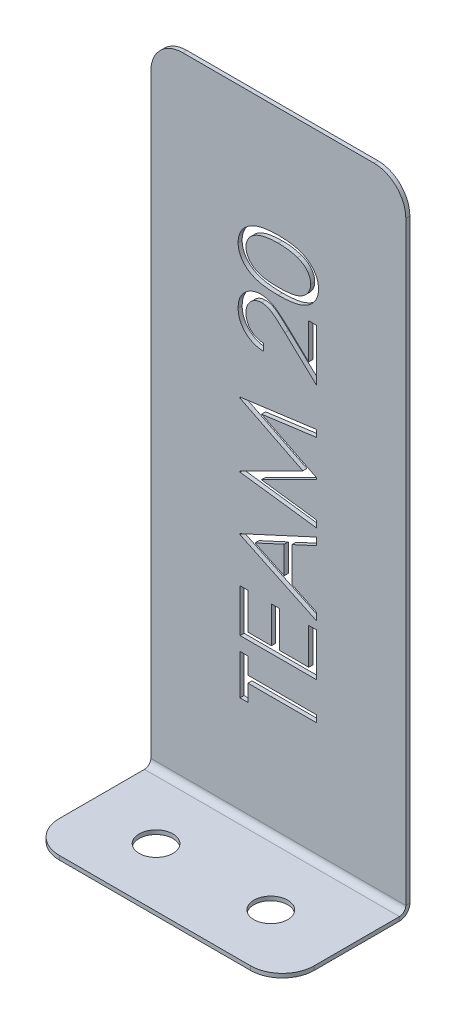
from build123d import *

# Parameters (mm, degrees)
SKETCH1_W                    = 40
SKETCH1_H                    = 100
BASE_FLANGE1_DEPTH           = 0.635
EDGE_FLANGE1_STRIP_W         = 4.54
EDGE_FLANGE1_STRIP_H         = 0.635
EDGE_FLANGE1_STRIP_CUT_DEPTH = 40
EDGE_FLANGE1_DEPTH           = 40
SKETCH9_R                    = 2.65
CUT_EXTRUDE1_DEPTH           = 104.191116139
FILLET1_R                    = 5
CUT_EXTRUDE2_DEPTH           = 58.227643888


# Sheet-metal steps are written as plain solids
with BuildPart() as part:
    # Sketch1 → Base-Flange1 (new body)
    with BuildSketch(Plane.XY):
        Rectangle(SKETCH1_W, SKETCH1_H)
    extrude(amount=-BASE_FLANGE1_DEPTH)

    # Edge-Flange1 strip (across the edge) → Edge-Flange1 strip cut (cut)
    with BuildSketch(Plane(origin=(-20, -50, 0), x_dir=(0, 1, 0), z_dir=(1, 0, 0))):
        with Locations((-0.635, -0.3175)):
            Rectangle(EDGE_FLANGE1_STRIP_W, EDGE_FLANGE1_STRIP_H)
    extrude(amount=EDGE_FLANGE1_STRIP_CUT_DEPTH, mode=Mode.SUBTRACT)

    # Edge-Flange1 section (across the edge) → Edge-Flange1 (add)
    with BuildSketch(Plane(origin=(-20, -50, 0), x_dir=(0, 1, 0), z_dir=(1, 0, 0))):
        with BuildLine():
            Line((0, 1), (0, 19.365))
            Line((0, 19.365), (0.635, 19.365))
            Line((0.635, 19.365), (0.635, 1))
            ThreePointArc((0.635, 1), (0.927893219, 0.292893219), (1.635, 0))
            Line((1.635, 0), (1.635, -0.635))
            ThreePointArc((1.635, -0.635), (0.478880413, -0.156119587), (0, 1))
        make_face()
    extrude(amount=EDGE_FLANGE1_DEPTH)

    # Sketch9 → Cut-Extrude1 (cut, through all)
    with BuildSketch(Plane(origin=(0, -49.365, 0), x_dir=(1, 0, 0), z_dir=(0, 1, 0))):
        with Locations(Location((-9, -10.1825, 0), (0, 0, 270))):
            Circle(SKETCH9_R)
        with Locations(Location((9, -10.1825, 0), (0, 0, 270))):
            Circle(SKETCH9_R)
    extrude(amount=-CUT_EXTRUDE1_DEPTH, mode=Mode.SUBTRACT)

    # Fillet1
    fillet1_edges = [part.edges().sort_by_distance(p)[0] for p in [
        (-20, -49.6825, 19.365),
        (20, -49.6825, 19.365),
        (-20, 50, -0.3175),
        (20, 50, -0.3175),
    ]]
    fillet(fillet1_edges, radius=FILLET1_R)

    # Sketch10 → Cut-Extrude2 (cut, through all)
    # profile 1 of 6: a face of its own
    with BuildSketch(Plane.XY):
        with BuildLine():
            add(Edge.make_bspline(
                [(0.004807692, 24.538461538), (-0.187526209, 24.539586172), (-0.561137583, 24.541770789), (-1.10554207, 24.566073947), (-1.616263062, 24.606446548), (-2.093325, 24.661774686), (-2.536851058, 24.729104896), (-2.945655912, 24.818986591), (-3.321631799, 24.921201827), (-3.666004222, 25.039667648), (-3.983414573, 25.173339059), (-4.279725727, 25.318831512), (-4.554511619, 25.481898185), (-4.812078451, 25.653292725), (-5.048492449, 25.8396875), (-5.266477552, 26.037085852), (-5.46419545, 26.249435775), (-5.64178154, 26.474677669), (-5.797498629, 26.711284965), (-5.935504277, 26.952792072), (-6.049178794, 27.203514183), (-6.142167679, 27.460150683), (-6.218076651, 27.723242465), (-6.270218337, 27.992722364), (-6.302967465, 28.269215054), (-6.306102418, 28.455836022), (-6.307692308, 28.550480769)],
                knots=[0, 0, 0, 0, 1.646148282, 3.197666765, 4.66315463, 6.030252048, 7.307778049, 8.501004361, 9.610818041, 10.641065266, 11.615491391, 12.557119604, 13.464013759, 14.348536654, 15.203310953, 16.038349431, 16.863300206, 17.683791446, 18.490318933, 19.285717724, 20.06220424, 20.843281102, 21.620494212, 22.403315558, 23.190242141, 24, 24, 24, 24], degree=3))
            add(Edge.make_bspline(
                [(-6.307692308, 28.550480769), (-6.306368022, 28.645962979), (-6.303733161, 28.83593897), (-6.266645896, 29.115796621), (-6.218776291, 29.390779629), (-6.142001326, 29.656715959), (-6.050130125, 29.918633956), (-5.928907534, 30.170020244), (-5.797068553, 30.419750089), (-5.636236086, 30.656478599), (-5.458489743, 30.887278788), (-5.256702203, 31.103629868), (-5.036457957, 31.31106235), (-4.792844916, 31.501741592), (-4.529598388, 31.68383984), (-4.244511611, 31.850444461), (-3.938216375, 32.005020527), (-3.612132621, 32.150473658), (-3.257550147, 32.277668581), (-2.876680574, 32.390755034), (-2.466074948, 32.483448518), (-2.028020601, 32.560104399), (-1.560347418, 32.619603954), (-1.064002958, 32.662906725), (-0.538676703, 32.685788475), (-0.179506822, 32.690096798), (0.004807692, 32.692307692)],
                knots=[0, 0, 0, 0, 0.810910589, 1.61342667, 2.396193133, 3.181089899, 3.963115317, 4.752255436, 5.550715454, 6.36105385, 7.181178335, 8.024612154, 8.872680183, 9.750181803, 10.651284446, 11.591556747, 12.554036451, 13.566402641, 14.62422919, 15.753422176, 16.94128843, 18.199818041, 19.531985927, 20.947085226, 22.433341622, 24, 24, 24, 24], degree=3))
            add(Edge.make_bspline(
                [(0.004807692, 32.692307692), (0.188316627, 32.690048158), (0.546676684, 32.685635691), (1.069663865, 32.663397475), (1.563332919, 32.618546268), (2.028210173, 32.56326151), (2.464511161, 32.485748854), (2.871951588, 32.392352513), (3.251973981, 32.285941271), (3.601855528, 32.156794249), (3.927373428, 32.014726657), (4.231416494, 31.860316464), (4.516427983, 31.694652019), (4.780368865, 31.515284822), (5.023004084, 31.321469101), (5.244003728, 31.11418201), (5.447074722, 30.895941931), (5.626779302, 30.663796218), (5.788836267, 30.424862727), (5.92545961, 30.175107511), (6.043835721, 29.920922476), (6.140619111, 29.659769829), (6.21567576, 29.392052774), (6.267273119, 29.11688129), (6.303542099, 28.835899477), (6.306304115, 28.645949769), (6.307692308, 28.550480769)],
                knots=[0, 0, 0, 0, 1.561645053, 3.049612875, 4.452756685, 5.778837748, 7.032101753, 8.221335837, 9.334924186, 10.387562255, 11.392109817, 12.355697819, 13.287721948, 14.19548756, 15.068665045, 15.927346723, 16.771751757, 17.602390507, 18.423119567, 19.225778204, 20.022010933, 20.807278863, 21.593079439, 22.384715467, 23.188155646, 24, 24, 24, 24], degree=3))
            add(Edge.make_bspline(
                [(6.307692308, 28.550480769), (6.306093375, 28.455838093), (6.302940591, 28.269221208), (6.270322083, 27.992698606), (6.217880356, 27.72430166), (6.144452007, 27.462705921), (6.05457254, 27.206569338), (5.937474301, 26.959381916), (5.802614241, 26.718396155), (5.649031442, 26.484251453), (5.473065645, 26.261361114), (5.278467095, 26.048419231), (5.060245625, 25.850972201), (4.821836902, 25.666193636), (4.563886857, 25.492987148), (4.286222382, 25.331329587), (3.988369362, 25.182786045), (3.668450488, 25.046830883), (3.321633866, 24.926291462), (2.944699582, 24.820228541), (2.533819106, 24.735519343), (2.091078561, 24.663715203), (1.615578331, 24.606177605), (1.107146387, 24.566090712), (0.566748199, 24.54178924), (0.195539345, 24.539591014), (0.004807692, 24.538461538)],
                knots=[0, 0, 0, 0, 0.810927267, 1.598990287, 2.382942141, 3.152806972, 3.926217614, 4.706701772, 5.493896336, 6.292070767, 7.104102563, 7.925577746, 8.761822141, 9.623241997, 10.509042271, 11.423174113, 12.375371989, 13.360203808, 14.400680605, 15.520553799, 16.714061498, 17.994519714, 19.364400916, 20.818312473, 22.365209998, 24, 24, 24, 24], degree=3))
        make_face()
        with BuildLine():
            add(Edge.make_bspline(
                [(0, 25.615384615), (0.160280612, 25.615803128), (0.471353808, 25.61661538), (0.922597775, 25.637220777), (1.344180174, 25.665901388), (1.735936465, 25.701983248), (2.09649747, 25.756020964), (2.427362174, 25.817330057), (2.727918151, 25.890866572), (3.000791904, 25.978302491), (3.249847436, 26.077900512), (3.481722958, 26.186453118), (3.699166629, 26.304102846), (3.901650898, 26.433261257), (4.086700617, 26.576481906), (4.259006374, 26.727125065), (4.412575526, 26.891977126), (4.596788427, 27.119979819), (4.787136655, 27.421001089), (4.952895609, 27.800269776), (5.057063798, 28.189990542), (5.070310992, 28.454509066), (5.076923077, 28.586538462)],
                knots=[0, 0, 0, 0, 1.459098681, 2.831824031, 4.11146945, 5.306290378, 6.412266529, 7.42953815, 8.369053297, 9.227277979, 10.03601793, 10.809473603, 11.557037441, 12.285528272, 12.993193355, 13.685654407, 14.36688038, 15.041354379, 16.352855396, 17.594313975, 18.799247529, 20, 20, 20, 20], degree=3))
            add(Edge.make_bspline(
                [(5.076923077, 28.586538462), (5.071133406, 28.719332124), (5.059574602, 28.984448402), (4.958693916, 29.37381117), (4.794693956, 29.748679123), (4.607327889, 30.044520938), (4.427750656, 30.268967564), (4.274820325, 30.429839203), (4.103533566, 30.577476791), (3.91873862, 30.717507796), (3.716889368, 30.845938625), (3.498960747, 30.962726607), (3.264346365, 31.069298062), (3.10056441, 31.130014794), (3.016826923, 31.161057692)],
                knots=[0, 0, 0, 0, 1.353621445, 2.702441307, 4.075953605, 5.516772412, 6.261413105, 7.007624062, 7.778524365, 8.566925914, 9.372323995, 10.217594641, 11.088702136, 12, 12, 12, 12], degree=3))
            add(Edge.make_bspline(
                [(3.016826923, 31.161057692), (2.909753531, 31.197235182), (2.692348625, 31.270691001), (2.355101818, 31.365359941), (2.00126377, 31.439915596), (1.632949084, 31.506989992), (1.247441538, 31.552771898), (0.845933936, 31.589621544), (0.428123551, 31.611326756), (0.144255009, 31.614017331), (0, 31.615384615)],
                knots=[0, 0, 0, 0, 0.884706709, 1.796334032, 2.740027952, 3.714592787, 4.726048262, 5.777819803, 6.87074269, 8, 8, 8, 8], degree=3))
            add(Edge.make_bspline(
                [(0, 31.615384615), (-0.144231677, 31.613498252), (-0.426379671, 31.609808123), (-0.839584861, 31.595703022), (-1.232045757, 31.559279339), (-1.605453089, 31.518825215), (-1.957739849, 31.459177607), (-2.291855154, 31.394865099), (-2.603659907, 31.308461037), (-2.898035279, 31.216164338), (-3.171638692, 31.110529833), (-3.425739063, 30.99424339), (-3.661586531, 30.87006823), (-3.87845239, 30.735132572), (-4.077594562, 30.591315934), (-4.254430796, 30.433461861), (-4.417563201, 30.271595254), (-4.600446673, 30.04138682), (-4.788389629, 29.742454163), (-4.956641247, 29.367915108), (-5.056217095, 28.980283332), (-5.070026059, 28.717692117), (-5.076923077, 28.586538462)],
                knots=[0, 0, 0, 0, 1.313483664, 2.569454835, 3.763100662, 4.901599063, 5.988328865, 7.015709358, 7.99797933, 8.932480776, 9.824041341, 10.666387587, 11.475829342, 12.24921787, 12.990555181, 13.709176526, 14.405678811, 15.080244297, 16.38186033, 17.610124501, 18.806354173, 20, 20, 20, 20], degree=3))
            add(Edge.make_bspline(
                [(-5.076923077, 28.586538462), (-5.0700089, 28.45379627), (-5.056167951, 28.188070063), (-4.957101755, 27.796298742), (-4.788881901, 27.419229449), (-4.600808766, 27.119311022), (-4.418264395, 26.891899234), (-4.262898118, 26.730522495), (-4.094707805, 26.577790121), (-3.908016485, 26.438278154), (-3.706245671, 26.309885614), (-3.491613925, 26.187689145), (-3.259305147, 26.080588173), (-3.010444906, 25.980670398), (-2.737556144, 25.893088638), (-2.435912652, 25.820392359), (-2.104257821, 25.754210994), (-1.74106235, 25.706549624), (-1.349222448, 25.664580622), (-0.926561924, 25.637535638), (-0.473768425, 25.616520986), (-0.161085787, 25.615770992), (0, 25.615384615)],
                knots=[0, 0, 0, 0, 1.207546505, 2.417292871, 3.651582144, 4.952510111, 5.626719005, 6.30238548, 6.989136872, 7.692112372, 8.420316868, 9.164734959, 9.937886623, 10.746308695, 11.604196049, 12.543341915, 13.568754172, 14.680483261, 15.875568977, 17.154711427, 18.534182925, 20, 20, 20, 20], degree=3))
        make_face(mode=Mode.SUBTRACT)
    # profile 2 of 6: a face of its own
    with BuildSketch(Plane.XY):
        with BuildLine():
            Line((-2.307692308, 16.846153846), (-2.307692308, 15.769230769))
            add(Edge.make_bspline(
                [(-2.307692308, 15.769230769), (-2.450563923, 15.77624958), (-2.731159973, 15.790034336), (-3.140270509, 15.854588471), (-3.531315533, 15.946957193), (-3.901155238, 16.077556464), (-4.25305972, 16.239749416), (-4.585631203, 16.434252367), (-4.897600993, 16.664631283), (-5.186077027, 16.925911514), (-5.450720127, 17.209689705), (-5.679252388, 17.515881498), (-5.872341547, 17.837635877), (-6.033762947, 18.173976673), (-6.154928133, 18.528698605), (-6.244830897, 18.898582689), (-6.298921226, 19.285254014), (-6.304735348, 19.548705518), (-6.307692308, 19.682692308)],
                knots=[0, 0, 0, 0, 1.10065271, 2.161652631, 3.183658789, 4.190468796, 5.17591951, 6.163126047, 7.15150782, 8.156236427, 9.156009102, 10.134482811, 11.092018607, 12.041330605, 13.001268258, 13.972401359, 14.968799086, 16, 16, 16, 16], degree=3))
            add(Edge.make_bspline(
                [(-6.307692308, 19.682692308), (-6.304636883, 19.814283536), (-6.298633084, 20.072855599), (-6.246298779, 20.450080081), (-6.166101121, 20.810042706), (-6.047260825, 21.148664023), (-5.89814225, 21.469419235), (-5.712693765, 21.768336863), (-5.499690168, 22.052645046), (-5.248441981, 22.308390434), (-4.98035953, 22.543323425), (-4.694049727, 22.745821459), (-4.397996574, 22.920214359), (-4.089887467, 23.062949501), (-3.768719052, 23.171149086), (-3.43757048, 23.251314609), (-3.092620073, 23.297141554), (-2.859105165, 23.304136188), (-2.740384615, 23.307692308)],
                knots=[0, 0, 0, 0, 1.111674182, 2.184400057, 3.212814286, 4.223731311, 5.211378316, 6.196328225, 7.191884489, 8.207283132, 9.220262353, 10.201199469, 11.166417575, 12.120932471, 13.06540007, 14.026332106, 14.996573967, 16, 16, 16, 16], degree=3))
            add(Edge.make_bspline(
                [(-2.740384615, 23.307692308), (-2.573246281, 23.301891759), (-2.241902654, 23.290392454), (-1.755037079, 23.191870984), (-1.283126365, 23.038386225), (-0.903358709, 22.852063406), (-0.596652896, 22.667430992), (-0.34466983, 22.499957826), (-0.074442404, 22.302443196), (0.217319277, 22.076495044), (0.525522546, 21.817462917), (0.858759913, 21.535684778), (1.206405091, 21.218586779), (1.444126443, 20.997021246), (1.567307692, 20.882211538)],
                knots=[0, 0, 0, 0, 1.184287764, 2.347792955, 3.508658517, 4.695561027, 5.337795753, 6.047029248, 6.840419152, 7.71111932, 8.663527678, 9.695323177, 10.80577421, 12, 12, 12, 12], degree=3))
            Line((1.567307692, 20.882211538), (4.769230769, 17.879807692))
            Line((4.769230769, 17.879807692), (4.769230769, 23.461538462))
            Line((4.769230769, 23.461538462), (6, 23.461538462))
            Line((6, 23.461538462), (6, 15.307692308))
            Line((6, 15.307692308), (1.033653846, 19.961538462))
            add(Edge.make_bspline(
                [(1.033653846, 19.961538462), (0.915373938, 20.074845502), (0.688182441, 20.292485138), (0.356492292, 20.600311115), (0.048779581, 20.876787647), (-0.2343743, 21.123704422), (-0.497111103, 21.335705012), (-0.730921516, 21.523838379), (-0.946079631, 21.674577548), (-1.195476022, 21.83817319), (-1.499975395, 21.996621126), (-1.872090901, 22.132777776), (-2.255155767, 22.215800113), (-2.514019894, 22.225759549), (-2.644230769, 22.230769231)],
                knots=[0, 0, 0, 0, 1.329631726, 2.553950428, 3.673215718, 4.687767853, 5.603093632, 6.413772471, 7.123043292, 7.734684054, 8.834405432, 9.900288307, 10.943827018, 12, 12, 12, 12], degree=3))
            add(Edge.make_bspline(
                [(-2.644230769, 22.230769231), (-2.726109849, 22.228589543), (-2.887477794, 22.224293797), (-3.124068967, 22.186381691), (-3.352291186, 22.129088527), (-3.572846452, 22.0469905), (-3.783517259, 21.938624534), (-3.984560048, 21.806715802), (-4.178922214, 21.654521299), (-4.361162094, 21.478459804), (-4.528069084, 21.285048879), (-4.675923091, 21.080725738), (-4.799485756, 20.864553952), (-4.900777747, 20.637444962), (-4.980236197, 20.400031924), (-5.035294183, 20.151855655), (-5.0698627, 19.893601885), (-5.07453986, 19.717258471), (-5.076923077, 19.627403846)],
                knots=[0, 0, 0, 0, 0.991446411, 1.95395049, 2.89581595, 3.838931463, 4.798493298, 5.75982156, 6.748411868, 7.785213223, 8.824556874, 9.840280684, 10.836137867, 11.835679398, 12.848801643, 13.863922112, 14.911575587, 16, 16, 16, 16], degree=3))
            add(Edge.make_bspline(
                [(-5.076923077, 19.627403846), (-5.074568272, 19.533537437), (-5.069943823, 19.349199308), (-5.034915941, 19.079124598), (-4.981813655, 18.819706061), (-4.897475636, 18.57481445), (-4.797826075, 18.339146796), (-4.671232047, 18.117734228), (-4.524126973, 17.906900621), (-4.353552641, 17.710113779), (-4.161900049, 17.530384761), (-3.950685662, 17.370248804), (-3.721430055, 17.231250812), (-3.475074138, 17.109806978), (-3.209165125, 17.01122748), (-2.924707355, 16.93588772), (-2.62291894, 16.876276583), (-2.41451305, 16.856361528), (-2.307692308, 16.846153846)],
                knots=[0, 0, 0, 0, 1.030878251, 2.024474673, 2.987898669, 3.934362936, 4.864849709, 5.795128259, 6.730474222, 7.685293701, 8.650606017, 9.611896181, 10.591709709, 11.591680886, 12.625074257, 13.701333388, 14.821793024, 16, 16, 16, 16], degree=3))
        make_face()
    # profile 3 of 6: a face of its own
    with BuildSketch(Plane.XY):
        Polygon((6, -4.076923077), (-6, -2.492788462), (-6, -2.338942308), (3.846153846, 2.615384615), (-6, 7.555288462), (-6, 7.709134615), (6, 9.307692308), (6, 8.230769231), (-2.627403846, 7.076923077), (6, 2.747596154), (6, 2.502403846), (-2.653846154, -1.846153846), (6, -2.992788462), align=None)
    # profile 4 of 6: a face of its own
    with BuildSketch(Plane.XY):
        Polygon((-6, -10.846153846), (6, -5.307692308), (6, -6.478365385), (2.153846154, -8.252403846), (2.153846154, -13.692307692), (6, -15.514423077), (6, -16.692307692), (-6, -11), align=None)
        Polygon((-3.658653846, -10.935096154), (0.923076923, -13.105769231), (0.923076923, -8.819711538), align=None, mode=Mode.SUBTRACT)
    # profile 5 of 6: a face of its own
    with BuildSketch(Plane.XY):
        Polygon((-6, -24.692307692), (-6, -17.923076923), (-4.769230769, -17.923076923), (-4.769230769, -23.615384615), (-1.076923077, -23.615384615), (-1.076923077, -17.923076923), (0.153846154, -17.923076923), (0.153846154, -23.615384615), (4.769230769, -23.615384615), (4.769230769, -17.923076923), (6, -17.923076923), (6, -24.692307692), align=None)
    # profile 6 of 6: a face of its own
    with BuildSketch(Plane.XY):
        Polygon((-4.769230769, -33.153846154), (-6, -33.153846154), (-6, -26.846153846), (-4.769230769, -26.846153846), (-4.769230769, -29.461538462), (6, -29.461538462), (6, -30.538461538), (-4.769230769, -30.538461538), align=None)
    extrude(amount=-CUT_EXTRUDE2_DEPTH, mode=Mode.SUBTRACT)


with BuildPart() as cut_extrude2_piece_1:
    # of the separate pieces the step leaves, piece 1, a body of its own (cut_extrude2_pieces)
    add(part.part.solids().sort_by_distance((-15, 50, 0))[0])


with BuildPart() as cut_extrude2_piece_2:
    # of the separate pieces the step leaves, piece 2, a body of its own (cut_extrude2_pieces)
    add(part.part.solids().sort_by_distance((0, 25.615384615, 0))[0])


with BuildPart() as cut_extrude2_piece_3:
    # of the separate pieces the step leaves, piece 3, a body of its own (cut_extrude2_pieces)
    add(part.part.solids().sort_by_distance((-3.658653846, -10.935096154, 0))[0])


solid = Compound([cut_extrude2_piece_1.part, cut_extrude2_piece_2.part, cut_extrude2_piece_3.part])
